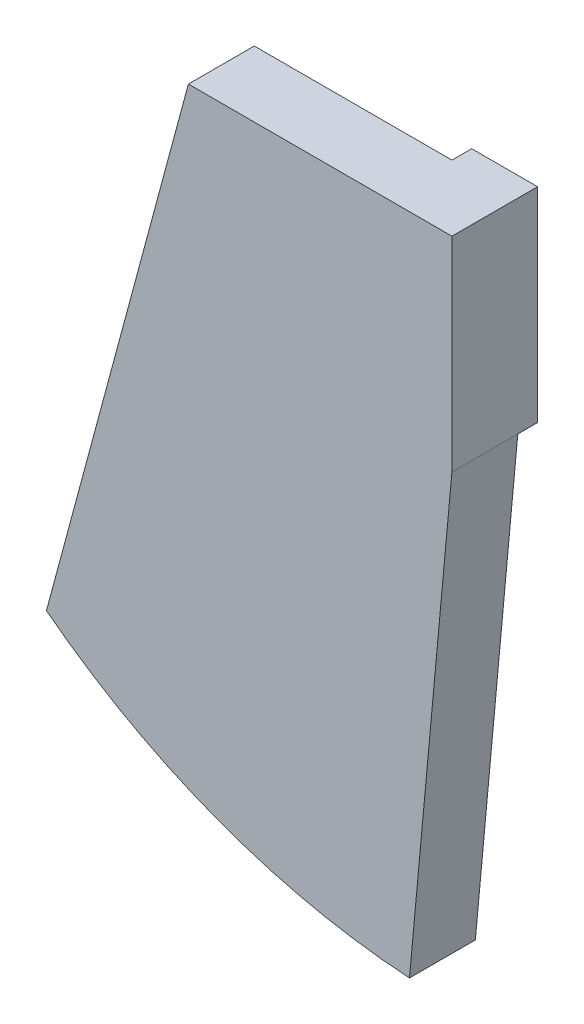
from build123d import *

# Parameters (mm, degrees)
SKETCH1_W           = 10
SKETCH1_H           = 31
BOSS_EXTRUDE1_DEPTH = 3
SKETCH2_R           = 1.5
CUT_EXTRUDE1_DEPTH  = 3
SHELL3_T            = -1
BOSS_EXTRUDE2_DEPTH = 10


with BuildPart() as part:
    # Sketch1 → Boss-Extrude1 (new body)
    with BuildSketch(Plane.XY):
        with Locations((0, -10.5)):
            Rectangle(SKETCH1_W, SKETCH1_H)
    extrude(amount=BOSS_EXTRUDE1_DEPTH)

    # Sketch2 → Cut-Extrude1 (cut)
    with BuildSketch(Plane(origin=(0, 0, 0), x_dir=(-1, 0, 0), z_dir=(0, 0, -1))):
        Circle(SKETCH2_R)
        with Locations((0, -21)):
            Circle(SKETCH2_R)
    extrude(amount=-CUT_EXTRUDE1_DEPTH, mode=Mode.SUBTRACT)

    # Shell3
    shell3_openings = [part.faces().sort_by_distance(p)[0] for p in [
        (0, -10.5, 0),
    ]]
    offset(amount=SHELL3_T, openings=shell3_openings, kind=Kind.INTERSECTION)

    # Sketch8 → Boss-Extrude2 (add)
    with BuildSketch(Plane.XY.offset(3)):
        with BuildLine():
            Line((5, -26), (-1.443498993, -95.730057569))
            ThreePointArc((-1.443498993, -95.730057569), (-30.540386695, -89.471922235), (-56.547243457, -75))
            Line((-56.547243457, -75), (-35, 5))
            Line((-35, 5), (-5, 5))
            Line((-5, 5), (5, 5))
            Line((5, 5), (5, -26))
        make_face()
    extrude(amount=BOSS_EXTRUDE2_DEPTH)


solid = part.part
